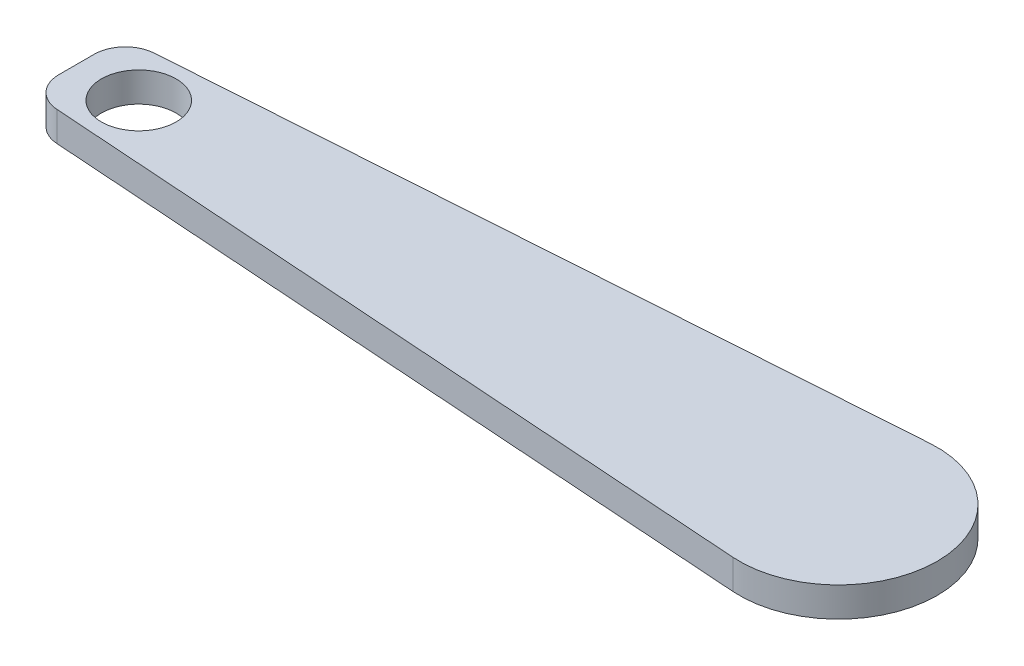
from build123d import *

# Parameters (mm, degrees)
SKETCH2_R           = 6
BOSS_EXTRUDE1_DEPTH = 4.7625
FILLET1_R           = 5


with BuildPart() as part:
    # Sketch2 → Boss-Extrude1 (new body)
    with BuildSketch(Plane(origin=(0, 0, 0), x_dir=(1, 0, 0), z_dir=(0, 1, 0))):
        with BuildLine():
            Line((-122.387926706, 7.5), (-122.387926706, -7.5))
            Line((-122.387926706, -7.5), (-1.088615545, -15.837630542))
            ThreePointArc((-1.088615545, -15.837630542), (15.875, 1.1e-07), (-1.088615765, 15.837630527))
            Line((-1.088615765, 15.837630527), (-122.387926706, 7.5))
        make_face()
        with Locations((-112.387926706, 0)):
            Circle(SKETCH2_R, mode=Mode.SUBTRACT)
    extrude(amount=BOSS_EXTRUDE1_DEPTH)

    # Fillet1
    fillet1_edges = [part.edges().sort_by_distance(p)[0] for p in [
        (-122.387926706, 2.38125, -7.5),
        (-122.387926706, 2.38125, 7.5),
    ]]
    fillet(fillet1_edges, radius=FILLET1_R)


solid = part.part
